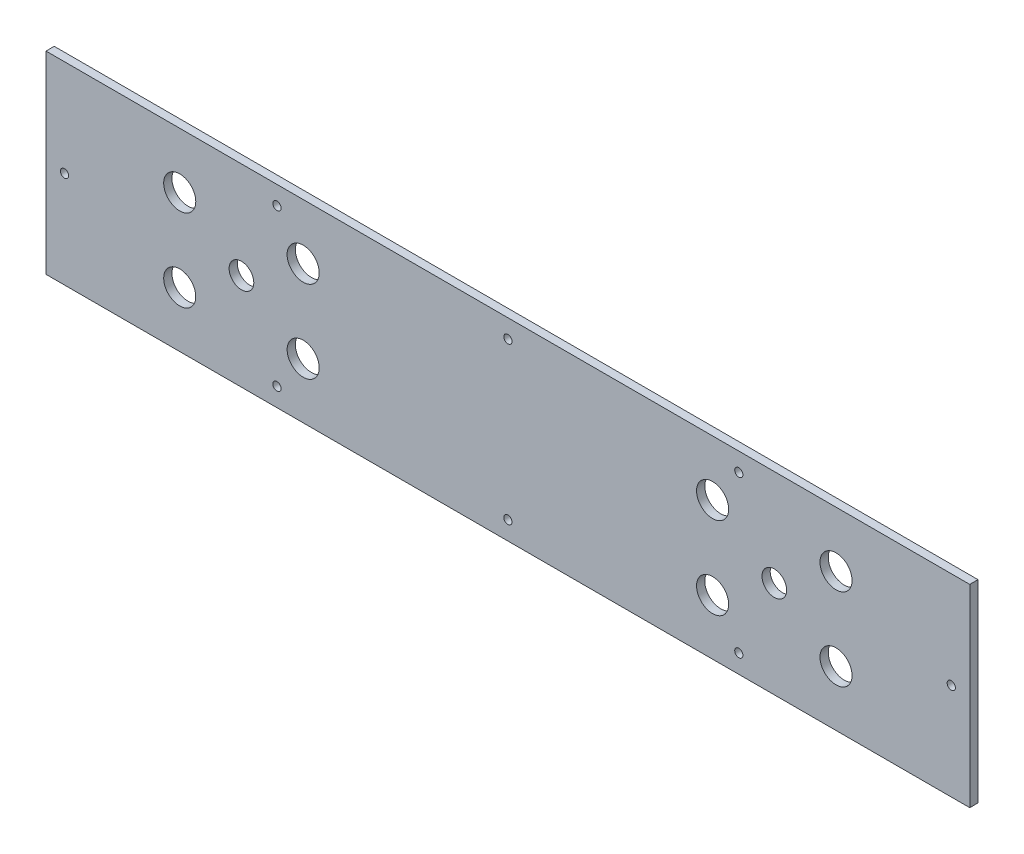
from build123d import *

# Parameters (mm, degrees)
SCHIZZO1_W                   = 449
SCHIZZO1_H                   = 94
SCHIZZO1_R                   = 7.8
SCHIZZO1_R_2                 = 2
SCHIZZO1_R_3                 = 6
ESTRUSIONE_ESTRUSIONE1_DEPTH = 4


with BuildPart() as part:
    # Schizzo1 → Estrusione-Estrusione1 (new body)
    with BuildSketch(Plane.XY):
        with Locations((-224.5, 47)):
            Rectangle(SCHIZZO1_W, SCHIZZO1_H)
        with Locations((-384, 27)):
            Circle(SCHIZZO1_R, mode=Mode.SUBTRACT)
        with Locations((-9, 47)):
            Circle(SCHIZZO1_R_2, mode=Mode.SUBTRACT)
        with Locations((-224.5, 85)):
            Circle(SCHIZZO1_R_2, mode=Mode.SUBTRACT)
        with Locations((-440, 47)):
            Circle(SCHIZZO1_R_2, mode=Mode.SUBTRACT)
        with Locations((-224.5, 9)):
            Circle(SCHIZZO1_R_2, mode=Mode.SUBTRACT)
        with Locations((-324, 27)):
            Circle(SCHIZZO1_R, mode=Mode.SUBTRACT)
        with Locations((-324, 67)):
            Circle(SCHIZZO1_R, mode=Mode.SUBTRACT)
        with Locations((-336.75, 85)):
            Circle(SCHIZZO1_R_2, mode=Mode.SUBTRACT)
        with Locations((-384, 67)):
            Circle(SCHIZZO1_R, mode=Mode.SUBTRACT)
        with Locations((-336.75, 9)):
            Circle(SCHIZZO1_R_2, mode=Mode.SUBTRACT)
        with Locations((-112.25, 9)):
            Circle(SCHIZZO1_R_2, mode=Mode.SUBTRACT)
        with Locations((-112.25, 85)):
            Circle(SCHIZZO1_R_2, mode=Mode.SUBTRACT)
        with Locations((-65, 67)):
            Circle(SCHIZZO1_R, mode=Mode.SUBTRACT)
        with Locations((-65, 27)):
            Circle(SCHIZZO1_R, mode=Mode.SUBTRACT)
        with Locations((-125, 27)):
            Circle(SCHIZZO1_R, mode=Mode.SUBTRACT)
        with Locations((-125, 67)):
            Circle(SCHIZZO1_R, mode=Mode.SUBTRACT)
        with Locations((-354, 47)):
            Circle(SCHIZZO1_R_3, mode=Mode.SUBTRACT)
        with Locations((-95, 47)):
            Circle(SCHIZZO1_R_3, mode=Mode.SUBTRACT)
    extrude(amount=ESTRUSIONE_ESTRUSIONE1_DEPTH)


solid = part.part
